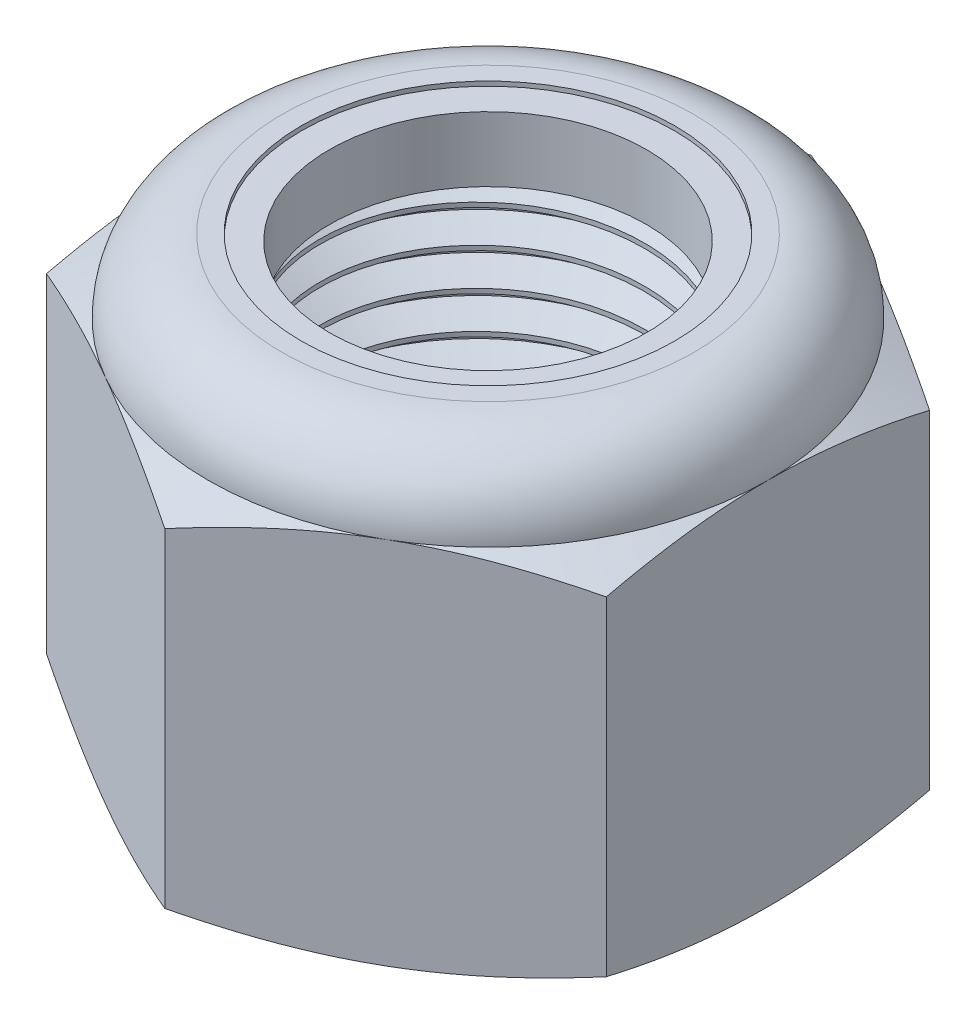
from build123d import *

# Parameters (mm, degrees)
SKETCH1_R        = 6.35
EXTRUDE1_DEPTH   = 15.08125
SKETCH2_W        = 6.35
SKETCH2_H        = 12.567708333
CUT_SWEEP1_PITCH = 1.27
SKETCH12_W       = 6.985
SKETCH12_H       = 12.567708333


with BuildPart() as part:
    # Sketch1 → Extrude1 (new body)
    with BuildSketch(Plane(origin=(0, 0, 0), x_dir=(1, 0, 0), z_dir=(0, 1, 0))):
        Polygon((0, 10.998522628), (-9.525, 5.499261314), (-9.525, -5.499261314), (0, -10.998522628), (9.525, -5.499261314), (9.525, 5.499261314), align=None)
        with Locations(Location((0, 0, 0), (0, 0, 90))):
            Circle(SKETCH1_R, mode=Mode.SUBTRACT)
    extrude(amount=EXTRUDE1_DEPTH)

    # Sketch5 → Cut-Revolve3 (revolve, cut)
    with BuildSketch(Plane(origin=(0, 0, 0), x_dir=(0, 0, -1), z_dir=(1, 0, 0))):
        with BuildLine():
            Line((0, 0), (9.525, 0))
            Line((9.525, 0), (10.998522628, 0.687114886))
            Line((10.998522628, 0.687114886), (10.998522628, 11.880593447))
            Line((10.998522628, 11.880593447), (9.525, 12.567708333))
            ThreePointArc((9.525, 12.567708333), (8.788800691, 14.345050691), (7.011458333, 15.08125))
            Line((7.011458333, 15.08125), (7.011458333, 16.35125))
            Line((7.011458333, 16.35125), (12.268522628, 16.35125))
            Line((12.268522628, 16.35125), (12.268522628, -1.27))
            Line((12.268522628, -1.27), (0, -1.27))
            Line((0, -1.27), (0, 0))
        make_face()
    revolve(axis=Axis((0, 0, 0), (0, 1, 0)), mode=Mode.SUBTRACT)

    # Sketch6 → Cut-Revolve4 (revolve, cut)
    with BuildSketch(Plane(origin=(0, 0, 0), x_dir=(0, 0, -1), z_dir=(1, 0, 0))):
        with BuildLine():
            Line((0, 12.567708333), (9.3726, 12.567708333))
            ThreePointArc((9.3726, 12.567708333), (8.681037617, 14.237287617), (7.011458333, 14.92885))
            Line((7.011458333, 14.92885), (3.505729167, 14.92885))
            Line((3.505729167, 14.92885), (3.505729167, 16.35125))
            Line((3.505729167, 16.35125), (0, 16.35125))
            Line((0, 16.35125), (0, 12.567708333))
        make_face()
    revolve(axis=Axis((0, 16.35125, 0), (0, -1, 0)), mode=Mode.SUBTRACT)

    # Sketch4 → Cut-Revolve2 (revolve, cut)
    with BuildSketch(Plane(origin=(0, 0, 0), x_dir=(0, 0, -1), z_dir=(1, 0, 0))):
        Polygon((0, 12.567708333), (6.985, 12.567708333), (0, 9.310549341), align=None)
        Polygon((0, 3.257158992), (6.985, 0), (0, 0), align=None)
    revolve(axis=Axis((0, 0, 0), (0, 1, 0)), mode=Mode.SUBTRACT)

    # Sketch12 → Revolve4 (revolve)
    with BuildSketch(Plane(origin=(0, 0, 0), x_dir=(0, 0, -1), z_dir=(1, 0, 0)), mode=Mode.PRIVATE) as revolve4_sk:
        with Locations((3.4925, 6.283854167)):
            Rectangle(SKETCH12_W, SKETCH12_H)
    revolve(revolve4_sk.sketch.rotate(Axis((0, 0, 0), (0, 1, 0)), 180), axis=Axis((0, 0, 0), (0, 1, 0)))


with BuildPart() as body_2:
    # Sketch7 → Revolve2 (revolve)
    with BuildSketch(Plane(origin=(0, 0, 0), x_dir=(0, 0, -1), z_dir=(1, 0, 0))):
        with BuildLine():
            Line((5.3975, 12.643908333), (9.295129058, 12.643908333))
            ThreePointArc((9.295129058, 12.643908333), (8.599986877, 14.210125907), (7.011458333, 14.85265))
            Line((7.011458333, 14.85265), (5.3975, 14.85265))
            Line((5.3975, 14.85265), (5.3975, 12.643908333))
        make_face()
    revolve(axis=Axis((0, 12.643908333, 0), (0, 1, 0)))


with BuildPart() as body_3:
    # Sketch2 → Revolve1 (revolve)
    with BuildSketch(Plane(origin=(0, 0, 0), x_dir=(0, 0, -1), z_dir=(1, 0, 0)), mode=Mode.PRIVATE) as revolve1_sk:
        with Locations((3.175, 6.283854167)):
            Rectangle(SKETCH2_W, SKETCH2_H)
    revolve(revolve1_sk.sketch.rotate(Axis((0, -6.35, 0), (0, 1, 0)), 180), axis=Axis((0, -6.35, 0), (0, 1, 0)))

    # Cut-Sweep1: the profile of Sketch9 screwed along a right-hand helix of 12.875 turns, 8 arcs to a turn; built about Z, then put on its axis
    cut_sweep1_z = Axis((0, 0, 0), (0, 0, 1))
    cut_sweep1_corners = [(6.487481533, 0, 0.079375), (6.418740766, 0, -1.1509375), (5.525110803, 0, -0.635), (5.525110803, 0, -0.47625)]
    with BuildLine(mode=Mode.PRIVATE) as cut_sweep1_profile:
        Line(cut_sweep1_corners[0], cut_sweep1_corners[1])
        Line(cut_sweep1_corners[1], cut_sweep1_corners[2])
        Line(cut_sweep1_corners[2], cut_sweep1_corners[3])
        Line(cut_sweep1_corners[3], cut_sweep1_corners[0])
    cut_sweep1_cap = Face(cut_sweep1_profile.wire())
    cut_sweep1_turn_angles = [0, 22.5, 45, 67.5, 90, 112.5, 135, 157.5, 180, 202.5, 225, 247.5, 270, 292.5, 315, 337.5, 360]
    cut_sweep1_turn_weights = [1, 0.9238795325112867, 1, 0.9238795325112867, 1, 0.9238795325112867, 1, 0.9238795325112867, 1, 0.9238795325112867, 1, 0.9238795325112867, 1, 0.9238795325112867, 1, 0.9238795325112867, 1]
    cut_sweep1_turn_rails = [Edge.make_bspline([Vector(p[0], p[1], 0).rotate(cut_sweep1_z, cut_sweep1_turn_angles[k]) / cut_sweep1_turn_weights[k] + Vector(0, 0, p[2] + CUT_SWEEP1_PITCH * cut_sweep1_turn_angles[k] / 360) for k in range(17)], [0, 0, 0, 1, 1, 2, 2, 3, 3, 4, 4, 5, 5, 6, 6, 7, 7, 8, 8, 8], 2, cut_sweep1_turn_weights) for p in cut_sweep1_corners]
    cut_sweep1_turn_sides = [Face.make_surface_from_curves(cut_sweep1_turn_rails[p[0]], cut_sweep1_turn_rails[p[1]]) for p in [(0, 1), (1, 2), (2, 3), (3, 0)]]
    cut_sweep1_last_angles = [4320, 4342.5, 4365, 4387.5, 4410, 4432.5, 4455, 4477.5, 4500, 4522.5, 4545, 4567.5, 4590, 4612.5, 4635]
    cut_sweep1_last_weights = [1, 0.9238795325112867, 1, 0.9238795325112867, 1, 0.9238795325112867, 1, 0.9238795325112867, 1, 0.9238795325112867, 1, 0.9238795325112867, 1, 0.9238795325112837, 1]
    cut_sweep1_last_rails = [Edge.make_bspline([Vector(p[0], p[1], 0).rotate(cut_sweep1_z, cut_sweep1_last_angles[k]) / cut_sweep1_last_weights[k] + Vector(0, 0, p[2] + CUT_SWEEP1_PITCH * cut_sweep1_last_angles[k] / 360) for k in range(15)], [0, 0, 0, 1, 1, 2, 2, 3, 3, 4, 4, 5, 5, 6, 6, 7, 7, 7], 2, cut_sweep1_last_weights) for p in cut_sweep1_corners]
    cut_sweep1_last_sides = [Face.make_surface_from_curves(cut_sweep1_last_rails[p[0]], cut_sweep1_last_rails[p[1]]) for p in [(0, 1), (1, 2), (2, 3), (3, 0)]]
    cut_sweep1 = Plane(origin=(0, 12.567708333, 0), x_dir=(0, 0, -1), z_dir=(0, -1, 0)) * Solid(Shell([*[p.moved(Location((0, 0, CUT_SWEEP1_PITCH * i))) for i in range(12) for p in cut_sweep1_turn_sides], *cut_sweep1_last_sides, cut_sweep1_cap, cut_sweep1_cap.rotate(cut_sweep1_z, 4635).moved(Location((0, 0, CUT_SWEEP1_PITCH * 4635 / 360)))]))
    add(cut_sweep1, mode=Mode.SUBTRACT)

    # Sketch11 → Revolve3 (revolve)
    with BuildSketch(Plane(origin=(0, 0, 0), x_dir=(0, 0, -1), z_dir=(1, 0, 0)), mode=Mode.PRIVATE) as revolve3_sk:
        Polygon((0, 0), (6.985, 0), (0, 3.257158992), align=None)
    revolve(revolve3_sk.sketch.rotate(Axis((0, 15.08125, 0), (0, -1, 0)), 309.33628863), axis=Axis((0, 15.08125, 0), (0, -1, 0)))


with BuildPart() as part_1:
    add(part.part)

    # Combine1: cut body 3
    add(body_3.part, mode=Mode.SUBTRACT)


solid = Compound([body_2.part, part_1.part])
